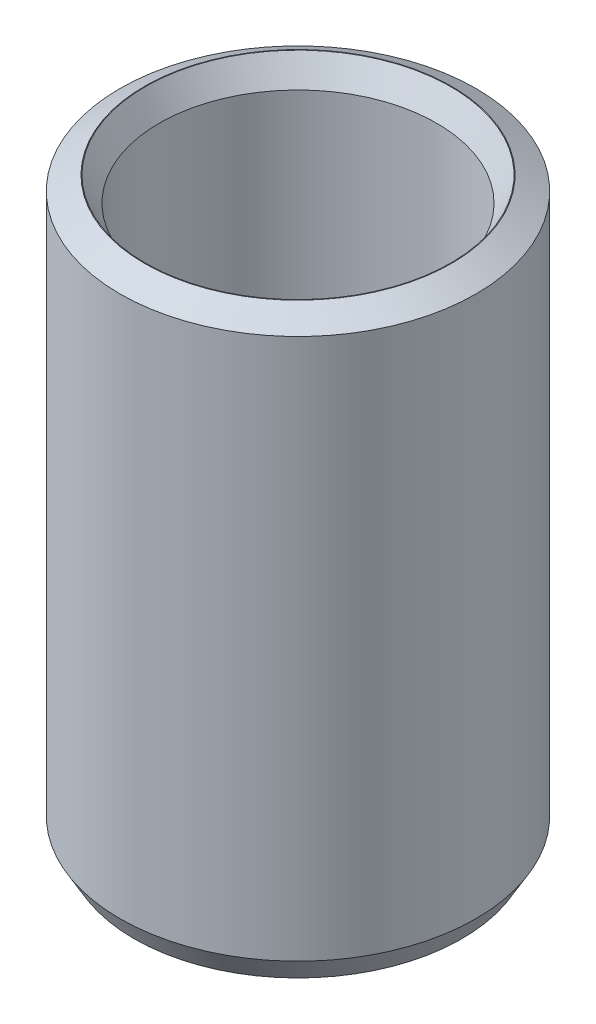
from build123d import *
from OCP.BRepFilletAPI import BRepFilletAPI_MakeChamfer

# Parameters (mm, degrees)
SKETCH1_R           = 30
BOSS_EXTRUDE1_DEPTH = 97.705534218
SKETCH2_R           = 23.368117555
CUT_EXTRUDE1_DEPTH  = 107.519347617
CHAMFER1_SIZE       = 2.384298784
CHAMFER1_SIZE2      = 4.129726634


with BuildPart() as part:
    # Sketch1 → Boss-Extrude1 (new body)
    with BuildSketch(Plane(origin=(0, 0, 0), x_dir=(1, 0, 0), z_dir=(0, 1, 0))):
        Circle(SKETCH1_R)
    extrude(amount=BOSS_EXTRUDE1_DEPTH)

    # Sketch2 → Cut-Extrude1 (cut, through all)
    with BuildSketch(Plane(origin=(0, 0, 0), x_dir=(1, 0, 0), z_dir=(0, 1, 0))):
        Circle(SKETCH2_R)
    extrude(amount=CUT_EXTRUDE1_DEPTH, mode=Mode.SUBTRACT)

    # Chamfer1: one chamfer whose edges measure the first distance from different faces: ONE call of the kernel's chamfer builder (chamfer() names one face for all edges)
    chamfer1_edges_1 = [part.edges().sort_by_distance(p)[0] for p in [
        (-23.368117555, 97.705534218, 0),
    ]]
    chamfer1_side_1 = [part.faces().sort_by_distance(p)[0] for p in [
        (-29.151471863, 97.705534218, 0),
    ]]
    chamfer1_edges_2 = [part.edges().sort_by_distance(p)[0] for p in [
        (-23.368117555, 0, 0),
    ]]
    chamfer1_side_2 = [part.faces().sort_by_distance(p)[0] for p in [
        (-23.368117555, 48.852767109, 0),
    ]]
    chamfer1_edges_3 = [part.edges().sort_by_distance(p)[0] for p in [
        (-30, 0, 0),
    ]]
    chamfer1_side_3 = [part.faces().sort_by_distance(p)[0] for p in [
        (-29.151471863, 0, 0),
    ]]
    chamfer1_edges_4 = [part.edges().sort_by_distance(p)[0] for p in [
        (-30, 97.705534218, 0),
    ]]
    chamfer1_side_4 = [part.faces().sort_by_distance(p)[0] for p in [
        (-30, 48.852767109, 0),
    ]]
    chamfer1 = BRepFilletAPI_MakeChamfer(part.part.solid().wrapped)
    for e in chamfer1_edges_1:
        chamfer1.Add(CHAMFER1_SIZE, CHAMFER1_SIZE2, e.wrapped, chamfer1_side_1[0].wrapped)  # the first distance lies on this face
    for e in chamfer1_edges_2:
        chamfer1.Add(CHAMFER1_SIZE, CHAMFER1_SIZE2, e.wrapped, chamfer1_side_2[0].wrapped)  # the first distance lies on this face
    for e in chamfer1_edges_3:
        chamfer1.Add(CHAMFER1_SIZE, CHAMFER1_SIZE2, e.wrapped, chamfer1_side_3[0].wrapped)  # the first distance lies on this face
    for e in chamfer1_edges_4:
        chamfer1.Add(CHAMFER1_SIZE, CHAMFER1_SIZE2, e.wrapped, chamfer1_side_4[0].wrapped)  # the first distance lies on this face
    add(Compound.cast(chamfer1.Shape()), mode=Mode.REPLACE)


solid = part.part
